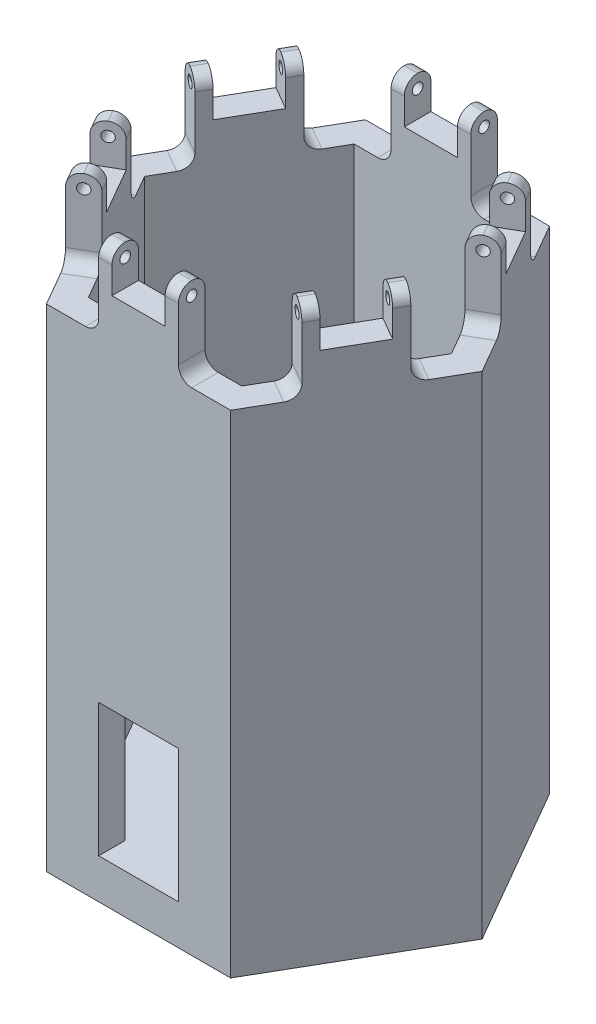
from build123d import *

# Parameters (mm, degrees)
BOSS_EXTRUDE1_DEPTH     = 15
BOSS_EXTRUDE3_DEPTH     = 170
SKETCH5_W               = 30
SKETCH5_H               = 10
BOSS_EXTRUDE4_DEPTH     = 30
CIRPATTERN2_COUNT       = 6
CUT_EXTRUDE1_REACH      = 264.726
SKETCH7_W               = 20
SKETCH7_H               = 15
CIRPATTERN4_COUNT       = 6
FILLET1_R               = 5
F_4_0_MM_DOWEL_HOLES1_D = 4
CIRPATTERN8_COUNT       = 6
CUT_EXTRUDE2_REACH      = 257.783
SKETCH11_W              = 30
SKETCH11_H              = 50
M3_CLEARANCE_HOLE1_D    = 3.6
LPATTERN1_COUNT         = 2
LPATTERN1_PITCH         = 31.04
LPATTERN1_COUNT_DIR2    = 2
LPATTERN1_PITCH_DIR2    = 31.04


with BuildPart() as part:
    # Sketch1 → Boss-Extrude1 (new body)
    with BuildSketch(Plane(origin=(0, 0, 0), x_dir=(1, 0, 0), z_dir=(0, 1, 0))):
        Polygon((-69.282032303, 0), (-34.641016151, 60), (34.641016151, 60), (69.282032303, 0), (34.641016151, -60), (-34.641016151, -60), align=None)
    extrude(amount=BOSS_EXTRUDE1_DEPTH)

    # Sketch4 → Boss-Extrude3 (add)
    with BuildSketch(Plane(origin=(0, 15, 0), x_dir=(1, 0, 0), z_dir=(0, 1, 0))):
        Polygon((-34.641016151, -60), (34.641016151, -60), (69.282032303, 0), (57.735026919, 0), (28.867513459, -50), (-28.867513459, -50), (-57.735026919, 0), (-69.282032303, 0), align=None)
    boss_extrude3 = extrude(amount=BOSS_EXTRUDE3_DEPTH)

    # Mirror1: Boss-Extrude3 across plane
    add(boss_extrude3.mirror(Plane(origin=(57.735026919, 185, 0), x_dir=(1, 0, 0), z_dir=(0, 0, 1))))

    # Sketch5 → Boss-Extrude4 (add)
    with BuildSketch(Plane(origin=(0, 185, 0), x_dir=(1, 0, 0), z_dir=(0, 1, 0))):
        with Locations((0, -55)):
            Rectangle(SKETCH5_W, SKETCH5_H)
    boss_extrude4 = extrude(amount=BOSS_EXTRUDE4_DEPTH)

    # CirPattern2: Boss-Extrude4 ×6 about axis
    cirpattern2_axis = Axis((0, 0, 0), (0, 1, 0))
    for i in range(1, CIRPATTERN2_COUNT):
        add(boss_extrude4.rotate(cirpattern2_axis, i * 360 / CIRPATTERN2_COUNT))

    # Sketch7 → Cut-Extrude1 (cut, up to next)
    with BuildSketch(Plane(origin=(-51.961524227, 0, 30), x_dir=(0.49999999999999695, 0, 0.8660254037844404), z_dir=(-0.8660254037844404, 0, 0.49999999999999695)), mode=Mode.PRIVATE) as cut_extrude1_sk1:
        with Locations((0, 207.5)):
            Rectangle(SKETCH7_W, SKETCH7_H)
    cut_extrude1_tool1 = extrude(cut_extrude1_sk1.sketch, amount=-CUT_EXTRUDE1_REACH, mode=Mode.PRIVATE) & part.part
    cut_extrude1 = cut_extrude1_tool1.solids().sort_by_distance((-51.961524, 207.5, 30))[0]
    add(cut_extrude1, mode=Mode.SUBTRACT)

    # CirPattern4: Cut-Extrude1 ×6 about axis
    cirpattern4_axis = Axis((0, 0, 0), (0, 1, 0))
    for i in range(1, CIRPATTERN4_COUNT):
        add(cut_extrude1.rotate(cirpattern4_axis, i * 360 / CIRPATTERN4_COUNT), mode=Mode.SUBTRACT)

    # Fillet1
    fillet1_edges = [part.edges().sort_by_distance(p)[0] for p in [
        (-55.131397208, 185, 14.509618943),
        (-40.131397208, 185, 40.490381057),
        (-40.131397208, 185, -40.490381057),
        (-55.131397208, 185, -14.509618943),
        (15, 185, -55),
        (-15, 185, -55),
        (55.131397208, 185, -14.509618943),
        (40.131397208, 185, -40.490381057),
        (40.131397208, 185, 40.490381057),
        (55.131397208, 185, 14.509618943),
        (-15, 185, 55),
        (15, 185, 55),
    ]]
    fillet(fillet1_edges, radius=FILLET1_R)
    fillet1_2_edges = [part.edges().sort_by_distance(p)[0] for p in [
        (-49.551270189, 215, 14.174682453),
        (-58.211524227, 215, 19.174682453),
        (-37.051270189, 215, -35.825317547),
        (-45.711524227, 215, -40.825317547),
        (12.5, 215, -50),
        (12.5, 215, -60),
        (49.551270189, 215, -14.174682453),
        (58.211524227, 215, -19.174682453),
        (37.051270189, 215, 35.825317547),
        (45.711524227, 215, 40.825317547),
        (-37.051270189, 215, 35.825317547),
        (-45.711524227, 215, 40.825317547),
        (49.551270189, 215, 14.174682453),
        (58.211524227, 215, 19.174682453),
        (-49.551270189, 215, -14.174682453),
        (-58.211524227, 215, -19.174682453),
        (-12.5, 215, -50),
        (-12.5, 215, -60),
        (37.051270189, 215, -35.825317547),
        (45.711524227, 215, -40.825317547),
        (12.5, 215, 50),
        (12.5, 215, 60),
        (-12.5, 215, 50),
        (-12.5, 215, 60),
    ]]
    fillet(fillet1_2_edges, radius=FILLET1_R - 0.0001)  # a hair under: the kernel refuses the full size

    # Ø4.0 mm Dowel Holes1 (through all)
    with Locations(Plane(origin=(15, 0, 0), x_dir=(0, 0, -1), z_dir=(1, 0, 0))):
        with Locations((-55, 210)):
            f_4_0_mm_dowel_holes1 = Hole(F_4_0_MM_DOWEL_HOLES1_D / 2)

    # CirPattern8: Ø4.0 mm Dowel Holes1 ×6 about axis
    cirpattern8_axis = Axis((0, 15, 0), (0, -1, 0))
    for i in range(1, CIRPATTERN8_COUNT):
        add(f_4_0_mm_dowel_holes1.rotate(cirpattern8_axis, i * 360 / CIRPATTERN8_COUNT), mode=Mode.SUBTRACT)

    # Sketch11 → Cut-Extrude2 (cut, up to next)
    with BuildSketch(Plane.XY.offset(60), mode=Mode.PRIVATE) as cut_extrude2_sk1:
        with Locations((0, 40)):
            Rectangle(SKETCH11_W, SKETCH11_H)
    cut_extrude2_tool1 = extrude(cut_extrude2_sk1.sketch, amount=-CUT_EXTRUDE2_REACH, mode=Mode.PRIVATE) & part.part
    add(cut_extrude2_tool1.solids().sort_by_distance((0, 40, 60))[0], mode=Mode.SUBTRACT)

    # M3 Clearance Hole1 (through all)
    with Locations(Plane(origin=(0, 0, 0), x_dir=(-1, 0, 0), z_dir=(0, -1, 0))):
        with Locations((-15.52, 15.52)):
            m3_clearance_hole1 = Hole(M3_CLEARANCE_HOLE1_D / 2)

    # LPattern1: M3 Clearance Hole1 2 × 2
    with Locations(*[(-i * LPATTERN1_PITCH, 0, j * LPATTERN1_PITCH_DIR2) for i in range(LPATTERN1_COUNT) for j in range(LPATTERN1_COUNT_DIR2) if (i, j) != (0, 0)]):
        add(m3_clearance_hole1, mode=Mode.SUBTRACT)


solid = part.part
